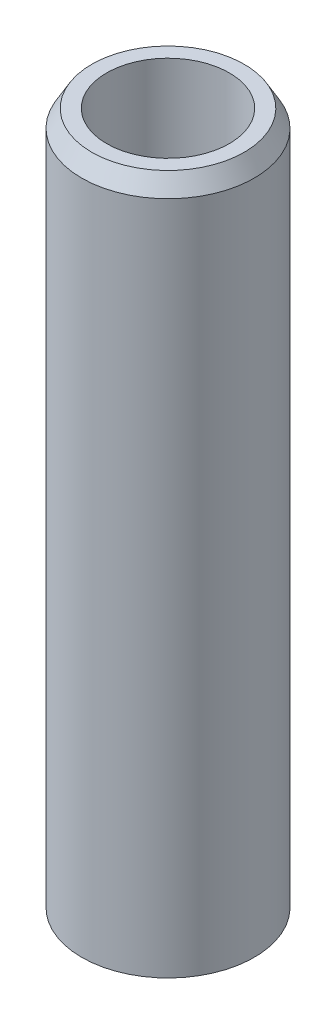
from build123d import *
from OCP.BRepFilletAPI import BRepFilletAPI_MakeChamfer

# Parameters (mm, degrees)
SKETCH1_R           = 17.5
BOSS_EXTRUDE1_DEPTH = 142.424779607
SKETCH2_R           = 12.440180063
CUT_EXTRUDE1_DEPTH  = 145.559046227
CHAMFER1_SIZE       = 3.523480805
CHAMFER1_SIZE2      = 2.034282591


with BuildPart() as part:
    # Sketch1 → Boss-Extrude1 (new body)
    with BuildSketch(Plane(origin=(0, 0, 0), x_dir=(1, 0, 0), z_dir=(0, 1, 0))):
        Circle(SKETCH1_R)
    extrude(amount=BOSS_EXTRUDE1_DEPTH)

    # Sketch2 → Cut-Extrude1 (cut, through all)
    with BuildSketch(Plane(origin=(0, 0, 0), x_dir=(1, 0, 0), z_dir=(0, 1, 0))):
        Circle(SKETCH2_R)
    extrude(amount=CUT_EXTRUDE1_DEPTH, mode=Mode.SUBTRACT)

    # Chamfer1: one chamfer whose edges measure the first distance from different faces: ONE call of the kernel's chamfer builder (chamfer() names one face for all edges)
    chamfer1_edges_1 = [part.edges().sort_by_distance(p)[0] for p in [
        (-17.5, 142.424779607, 0),
    ]]
    chamfer1_side_1 = [part.faces().sort_by_distance(p)[0] for p in [
        (-17.5, 71.212389803, 0),
    ]]
    chamfer1_edges_2 = [part.edges().sort_by_distance(p)[0] for p in [
        (-17.5, 0, 0),
    ]]
    chamfer1_side_2 = [part.faces().sort_by_distance(p)[0] for p in [
        (-17.005025253, 0, 0),
    ]]
    chamfer1 = BRepFilletAPI_MakeChamfer(part.part.solid().wrapped)
    for e in chamfer1_edges_1:
        chamfer1.Add(CHAMFER1_SIZE, CHAMFER1_SIZE2, e.wrapped, chamfer1_side_1[0].wrapped)  # the first distance lies on this face
    for e in chamfer1_edges_2:
        chamfer1.Add(CHAMFER1_SIZE, CHAMFER1_SIZE2, e.wrapped, chamfer1_side_2[0].wrapped)  # the first distance lies on this face
    add(Compound.cast(chamfer1.Shape()), mode=Mode.REPLACE)


solid = part.part
